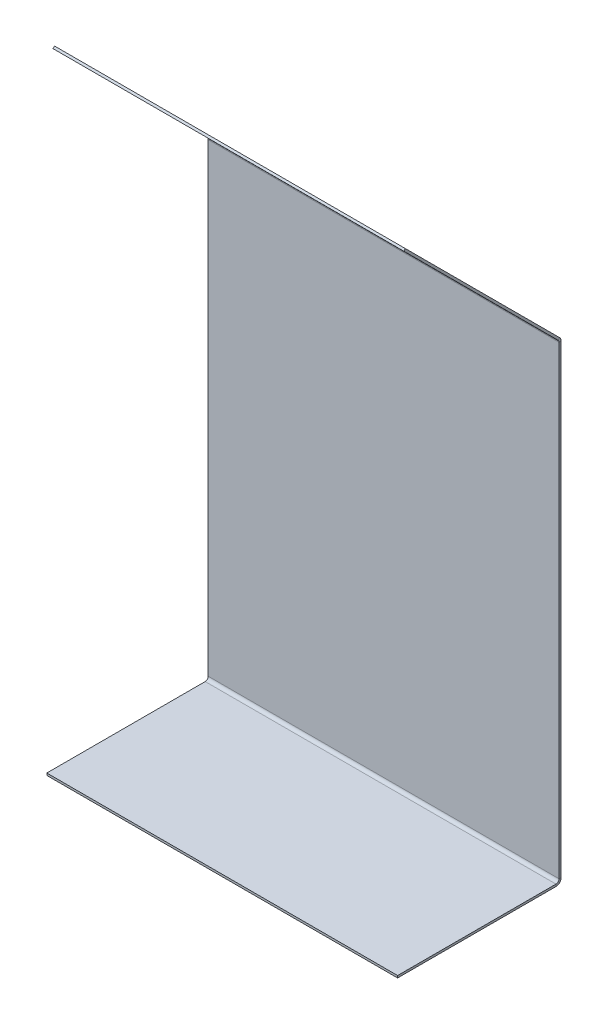
from build123d import *

# Parameters (mm, degrees)
SKETCH1_W          = 114.3
SKETCH1_H          = 50.8
BASE_FLANGE1_DEPTH = 0.7
EDGE_FLANGE1_DEPTH = 114.3
EDGE_FLANGE2_DEPTH = 114.3


# Sheet-metal steps are written as plain solids
with BuildPart() as part:
    # Sketch1 → Base-Flange1 (new body)
    with BuildSketch(Plane(origin=(0, 0, 0), x_dir=(1, 0, 0), z_dir=(0, 1, 0))):
        Rectangle(SKETCH1_W, SKETCH1_H)
    extrude(amount=-BASE_FLANGE1_DEPTH)

    # Edge-Flange1 section (across the edge) → Edge-Flange1 (add)
    with BuildSketch(Plane(origin=(57.15, 0, -27.2), x_dir=(0, 0, 1), z_dir=(-1, 0, 0))):
        with BuildLine():
            Line((-0.7, 1), (-0.7, 152.4))
            Line((-0.7, 152.4), (0, 152.4))
            Line((0, 152.4), (0, 1))
            ThreePointArc((0, 1), (0.292893219, 0.292893219), (1, 0))
            Line((1, 0), (1.8, 0))
            Line((1.8, 0), (1.8, -0.7))
            Line((1.8, -0.7), (1, -0.7))
            ThreePointArc((1, -0.7), (-0.202081528, -0.202081528), (-0.7, 1))
        make_face()
    extrude(amount=EDGE_FLANGE1_DEPTH)

    # Edge-Flange2 section (across the edge) → Edge-Flange2 (add)
    with BuildSketch(Plane(origin=(57.15, 152.814213562, -27.2), x_dir=(0, -0.7071067811865414, 0.7071067811865537), z_dir=(-1, 0, 0))):
        with BuildLine():
            Line((-0.7, 0.414213562), (-0.7, 71.541250506))
            Line((-0.7, 71.541250506), (0, 71.541250506))
            Line((0, 71.541250506), (0, 0.414213562))
            ThreePointArc((0, 0.414213562), (0.076120467, 0.03153013), (0.292893219, -0.292893219))
            Line((0.292893219, -0.292893219), (-0.202081528, -0.787867966))
            ThreePointArc((-0.202081528, -0.787867966), (-0.570595205, -0.236348273), (-0.7, 0.414213562))
        make_face()
    extrude(amount=EDGE_FLANGE2_DEPTH)


solid = part.part
